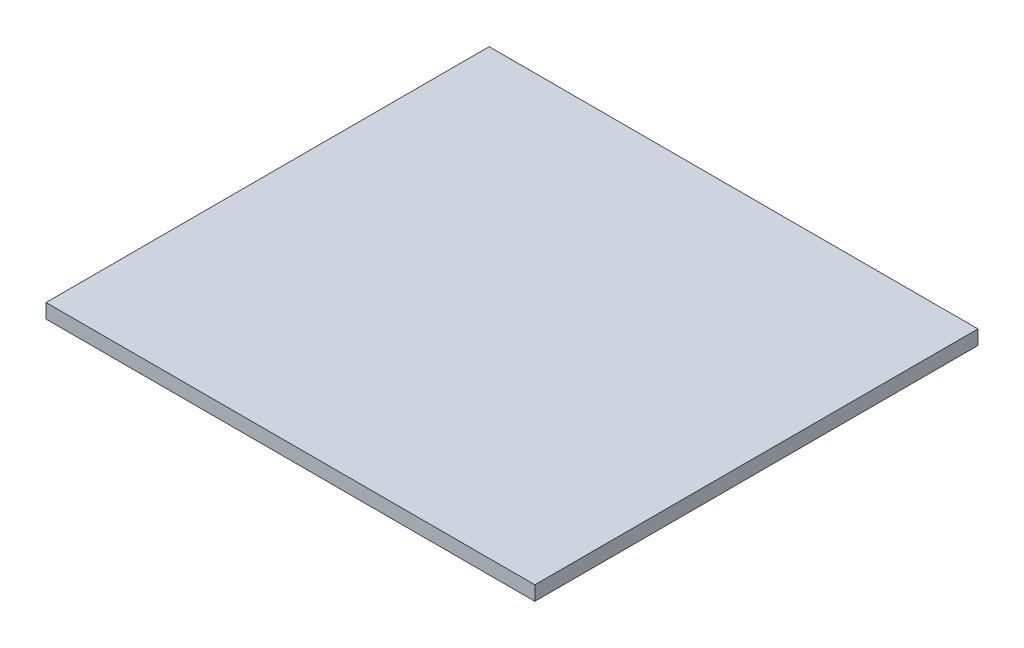
from build123d import *

# Parameters (mm, degrees)
SKETCH1_W           = 109
SKETCH1_H           = 98.8
BOSS_EXTRUDE1_DEPTH = 3.2


with BuildPart() as part:
    # Sketch1 → Boss-Extrude1 (new body)
    with BuildSketch(Plane(origin=(0, 0, 0), x_dir=(1, 0, 0), z_dir=(0, 1, 0))):
        with Locations((10.218457944, -28.701985981)):
            Rectangle(SKETCH1_W, SKETCH1_H)
    extrude(amount=BOSS_EXTRUDE1_DEPTH)


solid = part.part
